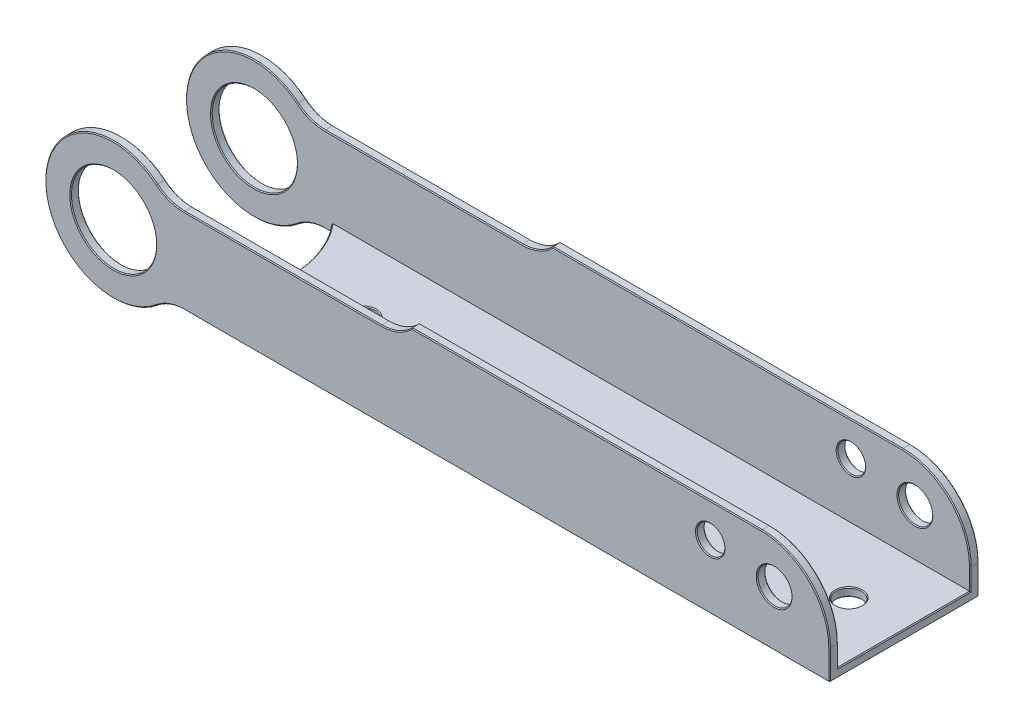
from build123d import *

# Parameters (mm, degrees)
ARMA_W_DEPTH             = 17.5
FILLET_1_R               = 16
FILLET_2_R               = 10
SKETCH_2_R               = 10
CUT_EXTRUDE_1_DEPTH      = 173.351385257
CUT_EXTRUDE_2_DEPTH      = 170.665111322
CUT_EXTRUDE_2_DEPTH_BACK = 170.665111322
ARMA_T_W                 = 31
ARMA_T_H                 = 21
CUT_EXTRUDE_3_DEPTH      = 170.665111322
SKETCH_5_R               = 4
SKETCH_5_R_2             = 3.25
CUT_EXTRUDE_4_DEPTH      = 173.351385257
CUT_EXTRUDE_5_REACH      = 172.898
SKETCH_6_R               = 3
CHAMFER_1_SIZE           = 0.2


with BuildPart() as part:
    # ArmA-L → ArmA-W (new, symmetric)
    with BuildSketch(Plane.XY):
        with BuildLine():
            Line((12.489995997, 10), (70, 10))
            Line((70, 10), (70, 13))
            Line((70, 13), (168, 13))
            Line((168, 13), (168, -10))
            Line((168, -10), (12.489995997, -10))
            ThreePointArc((12.489995997, -10), (-16, 0), (12.489995997, 10))
        make_face()
    extrude(amount=ARMA_W_DEPTH, both=True)

    # ﾌｨﾚｯﾄ1
    fillet_1_edges = [part.edges().sort_by_distance(p)[0] for p in [
        (168, 13, 0),
    ]]
    fillet(fillet_1_edges, radius=FILLET_1_R)

    # ﾌｨﾚｯﾄ2
    # the kernel refuses this fillet: 10 mm, written as the material it adds along each edge
    with BuildSketch(Plane(origin=(12.489995997, -10, -17.5), x_dir=(1, 0, 0), z_dir=(0, 0, 1))) as fillet_2_piece_1:
        with BuildLine():
            CenterArc((4.123251729, -10), FILLET_2_R, 90, 39.715137232)
            Line((-2.266458935, -2.307692308), (-2.394253148, -2.153846154))
            ThreePointArc((-2.394253148, -2.153846154), (-1.217455031, -1.071125515), (-0.15612495, 0.125))
            Line((-0.15612495, 0.125), (0, 0.2))
            Line((0, 0.2), (4.123251729, 0.2))
            Line((4.123251729, 0.2), (4.123251729, 0))
        make_face()
    extrude(amount=35)
    with BuildSketch(Plane(origin=(12.489995997, 10, -17.5), x_dir=(1, 0, 0), z_dir=(0, 0, 1))) as fillet_2_piece_2:
        with BuildLine():
            CenterArc((4.123251729, 10), FILLET_2_R, 230.284862768, 39.715137232)
            Line((-2.266458935, 2.307692308), (-2.394253148, 2.153846154))
            ThreePointArc((-2.394253148, 2.153846154), (-1.217455031, 1.071125515), (-0.15612495, -0.125))
            Line((-0.15612495, -0.125), (0, -0.2))
            Line((0, -0.2), (4.123251729, -0.2))
            Line((4.123251729, -0.2), (4.123251729, 0))
        make_face()
    extrude(amount=35)
    with BuildSketch(Plane(origin=(70, 10, 17.5), x_dir=(0, 1, 0), z_dir=(0, 0, -1))) as fillet_2_piece_3:
        with BuildLine():
            CenterArc((10, -7.141428429), FILLET_2_R, 134.427004001, 45.572995999)
            Line((0, -7.141428429), (-0.2, -7.141428429))
            Line((-0.2, -7.141428429), (-0.2, 0))
            Line((-0.2, 0), (0, 0.2))
            ThreePointArc((0, 0.2), (1.5, 0.2), (2.86, 0.142828569))
            Line((2.86, 0.142828569), (3, 0))
        make_face()
    extrude(amount=35)

    # ｽｹｯﾁ2 → ｶｯﾄ - 押し出し1 (cut, through all)
    with BuildSketch(Plane.XY.offset(17.5)):
        Circle(SKETCH_2_R)
    extrude(amount=-CUT_EXTRUDE_1_DEPTH, mode=Mode.SUBTRACT)

    # ｽｹｯﾁ3 → ｶｯﾄ - 押し出し2 (cut, two sides: drawn at the far end of the back side and taken through both)
    with BuildSketch(Plane(origin=(0, 0, 0), x_dir=(1, 0, 0), z_dir=(0, 1, 0)).offset(-CUT_EXTRUDE_2_DEPTH_BACK)):
        with BuildLine():
            Line((-16, 15.5), (-16, -15.5))
            Line((-16, -15.5), (18.323482202, -15.5))
            ThreePointArc((18.323482202, -15.5), (24, 0), (18.323482202, 15.5))
            Line((18.323482202, 15.5), (-16, 15.5))
        make_face()
    extrude(amount=CUT_EXTRUDE_2_DEPTH + CUT_EXTRUDE_2_DEPTH_BACK, mode=Mode.SUBTRACT)

    # ArmA-t → ｶｯﾄ - 押し出し3 (cut, through all)
    with BuildSketch(Plane(origin=(0, 0, 0), x_dir=(0, 0, -1), z_dir=(1, 0, 0))):
        with Locations((0, 2.5)):
            Rectangle(ARMA_T_W, ARMA_T_H)
    extrude(amount=CUT_EXTRUDE_3_DEPTH, mode=Mode.SUBTRACT)

    # ｽｹｯﾁ5 → ｶｯﾄ - 押し出し4 (cut, through all)
    with BuildSketch(Plane.XY.offset(17.5)):
        with Locations((155, 3)):
            Circle(SKETCH_5_R)
        with Locations((140, 5)):
            Circle(SKETCH_5_R_2)
    extrude(amount=-CUT_EXTRUDE_4_DEPTH, mode=Mode.SUBTRACT)

    # ｽｹｯﾁ6 → ｶｯﾄ - 押し出し5 (cut, up to next)
    with BuildSketch(Plane.XZ.offset(10), mode=Mode.PRIVATE) as cut_extrude_5_sk1:
        with Locations(Location((155, 0, 0), (0, 0, 270))):
            Circle(SKETCH_6_R)
    cut_extrude_5_tool1 = extrude(cut_extrude_5_sk1.sketch, amount=-CUT_EXTRUDE_5_REACH, mode=Mode.PRIVATE) & part.part
    # ｽｹｯﾁ6 → ｶｯﾄ - 押し出し5 (cut, up to next)
    with BuildSketch(Plane.XZ.offset(10), mode=Mode.PRIVATE) as cut_extrude_5_sk2:
        with Locations(Location((41, 0, 0), (0, 0, 270))):
            Circle(SKETCH_6_R)
    cut_extrude_5_tool2 = extrude(cut_extrude_5_sk2.sketch, amount=-CUT_EXTRUDE_5_REACH, mode=Mode.PRIVATE) & part.part
    add(cut_extrude_5_tool1.solids().sort_by_distance((155, -10, 0))[0], mode=Mode.SUBTRACT)
    add(cut_extrude_5_tool2.solids().sort_by_distance((41, -10, 0))[0], mode=Mode.SUBTRACT)

    # 面取り1
    chamfer_1_edges = [part.edges().sort_by_distance(p)[0] for p in [
        (168, -6.5, 17.5),
        (163.313708499, 8.313708499, -15.5),
        (111, 13, -15.5),
        (24, -8, 0),
        (66.731554918, 10.780455543, -15.5),
        (168, -5.5, -15.5),
        (168, -5.5, 15.5),
        (168, -8, 0),
        (168, -10, 0),
        (151, 3, -17.5),
        (151, 3, -15.5),
        (151, 3, 15.5),
        (151, 3, 17.5),
        (136.75, 5, -17.5),
        (136.75, 5, -15.5),
        (136.75, 5, 15.5),
        (136.75, 5, 17.5),
        (155, -8, 3),
        (155, -10, 3),
        (41, -8, 3),
        (41, -10, 3),
        (111, 13, -17.5),
        (111, 13, 17.5),
        (163.313708499, 8.313708499, -17.5),
        (163.313708499, 8.313708499, 17.5),
        (39.735909649, 10, -17.5),
        (39.735909649, 10, 17.5),
        (92.306623863, -10, -17.5),
        (92.306623863, -10, 17.5),
        (-16, 0, -17.5),
        (-16, 0, 17.5),
        (66.731554918, 10.780455543, -17.5),
        (66.731554918, 10.780455543, 17.5),
        (13.216416623, -10.594600569, -17.5),
        (13.216416623, -10.594600569, 17.5),
        (13.216416623, 10.594600569, -17.5),
        (13.216416623, 10.594600569, 17.5),
        (-10, 0, -17.5),
        (-10, 0, 17.5),
        (24, -10, 0),
        (-10, 0, -15.5),
        (17.468364964, -10, -15.5),
        (13.216416623, -10.594600569, -15.5),
        (-16, 0, -15.5),
        (13.216416623, 10.594600569, -15.5),
        (39.735909649, 10, -15.5),
        (-10, 0, 15.5),
        (13.216416623, -10.594600569, 15.5),
        (17.468364964, -10, 15.5),
        (39.735909649, 10, 15.5),
        (13.216416623, 10.594600569, 15.5),
        (-16, 0, 15.5),
        (168, -6.5, -17.5),
        (66.731554918, 10.780455543, 15.5),
        (163.313708499, 8.313708499, 15.5),
        (111, 13, 15.5),
    ]]
    chamfer(chamfer_1_edges, length=CHAMFER_1_SIZE)


solid = part.part
